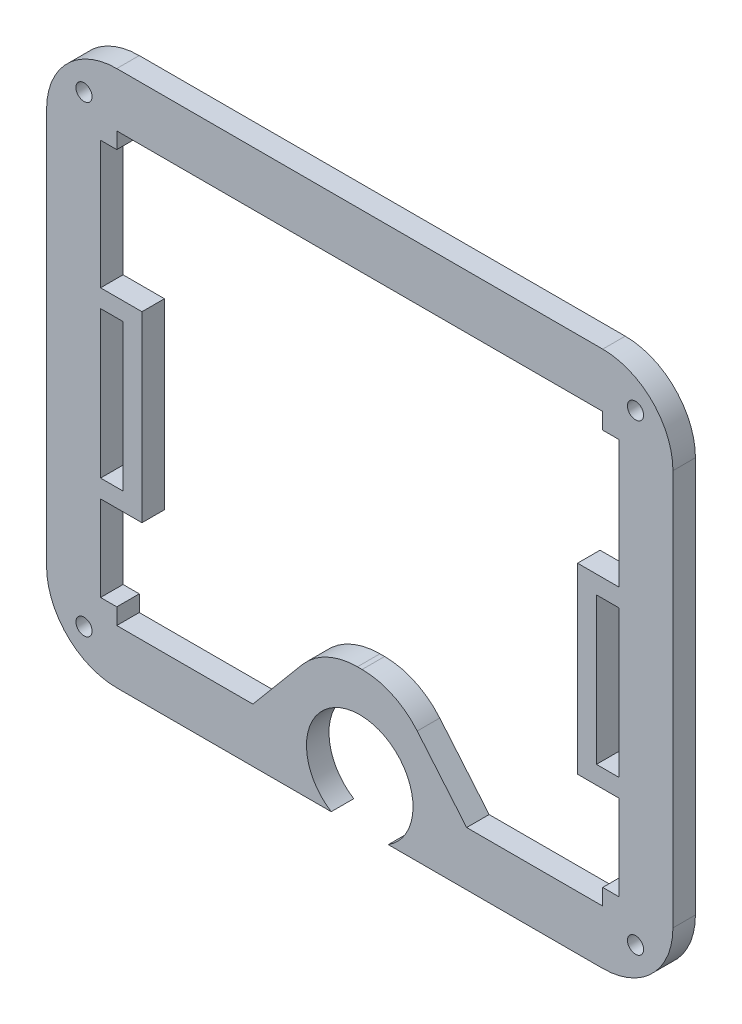
from build123d import *

# Parameters (mm, degrees)
SKETCH1_R           = 0.5715
BOSS_EXTRUDE1_DEPTH = 1.5875
SKETCH2_W           = 1.5875
SKETCH2_H           = 12.897248124
BOSS_EXTRUDE2_DEPTH = 2.921
CUT_EXTRUDE1_DEPTH  = 1.5875


with BuildPart() as part:
    # Sketch1 → Boss-Extrude1 (new body)
    with BuildSketch(Plane.XY):
        with BuildLine():
            Line((-17.145, -18.923), (-2.01269959, -18.923))
            ThreePointArc((-2.01269959, -18.923), (0, -11.9888), (2.01269959, -18.923))
            Line((2.01269959, -18.923), (17.145, -18.923))
            ThreePointArc((17.145, -18.923), (20.647299887, -17.472299887), (22.098, -13.97))
            Line((22.098, -13.97), (22.098, 13.97))
            ThreePointArc((22.098, 13.97), (20.647299887, 17.472299887), (17.145, 18.923))
            Line((17.145, 18.923), (-17.145, 18.923))
            ThreePointArc((-17.145, 18.923), (-20.647299887, 17.472299887), (-22.098, 13.97))
            Line((-22.098, 13.97), (-22.098, -13.97))
            ThreePointArc((-22.098, -13.97), (-20.647299887, -17.472299887), (-17.145, -18.923))
        make_face()
        with Locations((-19.457528855, 16.326805286)):
            Circle(SKETCH1_R, mode=Mode.SUBTRACT)
        with Locations((19.457528855, 16.326805286)):
            Circle(SKETCH1_R, mode=Mode.SUBTRACT)
        with Locations((19.457528855, -16.326805286)):
            Circle(SKETCH1_R, mode=Mode.SUBTRACT)
        with Locations((-19.457528855, -16.326805286)):
            Circle(SKETCH1_R, mode=Mode.SUBTRACT)
        with BuildLine():
            Line((-18.288, 13.97), (-18.288, -13.97))
            Line((-18.288, -13.97), (-17.145, -13.97))
            Line((-17.145, -13.97), (-17.145, -15.113))
            Line((-17.145, -15.113), (-7.542517063, -15.113))
            Line((-7.542517063, -15.113), (-4.056594232, -10.958638943))
            ThreePointArc((-4.056594232, -10.958638943), (-2.31198923, -9.619956442), (-0.165088461, -9.144))
            Line((-0.165088461, -9.144), (0.165088461, -9.144))
            ThreePointArc((0.165088461, -9.144), (2.31198923, -9.619956442), (4.056594232, -10.958638943))
            Line((4.056594232, -10.958638943), (7.542517063, -15.113))
            Line((7.542517063, -15.113), (17.145, -15.113))
            Line((17.145, -15.113), (17.145, -13.97))
            Line((17.145, -13.97), (18.288, -13.97))
            Line((18.288, -13.97), (18.288, 13.97))
            Line((18.288, 13.97), (17.145, 13.97))
            Line((17.145, 13.97), (17.145, 15.113))
            Line((17.145, 15.113), (-17.145, 15.113))
            Line((-17.145, 15.113), (-17.145, 13.97))
            Line((-17.145, 13.97), (-18.288, 13.97))
        make_face(mode=Mode.SUBTRACT)
    extrude(amount=BOSS_EXTRUDE1_DEPTH)

    # Sketch2 → Boss-Extrude2 (add)
    with BuildSketch(Plane(origin=(-18.288, 0, 0), x_dir=(0, 0, -1), z_dir=(1, 0, 0))):
        with Locations((-0.79375, -1.49552727)):
            Rectangle(SKETCH2_W, SKETCH2_H)
    boss_extrude2 = extrude(amount=BOSS_EXTRUDE2_DEPTH)

    # Sketch2<3> → Cut-Extrude1 (cut)
    with BuildSketch(Plane(origin=(-18.288, 0, 0), x_dir=(0, 0, -1), z_dir=(1, 0, 0))):
        Polygon((0, 1.143067611), (0, 3.683096792), (-1.5875, 3.683096792), (-1.5875, -6.644691549), (-1.5875, -6.674151332), (0, -6.674151332), align=None)
    cut_extrude1 = extrude(amount=CUT_EXTRUDE1_DEPTH, mode=Mode.SUBTRACT)

    # Mirror1: Boss-Extrude2, Cut-Extrude1 across plane
    add(boss_extrude2.mirror(Plane(origin=(0, 0, 0), x_dir=(0, 0, 1), z_dir=(1, 0, 0))))
    add(cut_extrude1.mirror(Plane(origin=(0, 0, 0), x_dir=(0, 0, 1), z_dir=(1, 0, 0))), mode=Mode.SUBTRACT)


solid = part.part
